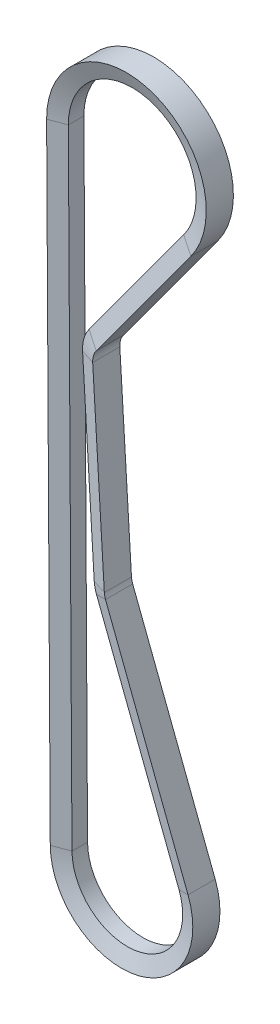
from build123d import *


with BuildPart() as part:
    # Sweep1: sweep along a path in Sketch2
    with BuildLine(Plane.XY) as sweep1_path:
        Line((24.305304687, 203.443011904), (-8.902554145, 158.126250847))
        ThreePointArc((-8.902554145, 158.126250847), (-9.872370593, 156.165208625), (-10.1190974, 153.991420129))
        Line((-10.1190974, 153.991420129), (-6.034091354, 86.114231578))
        ThreePointArc((-6.034091354, 86.114231578), (-5.901062985, 85.148765527), (-5.621860178, 84.215027323))
        Line((-5.621860178, 84.215027323), (23.331891345, 8.979022567))
        ThreePointArc((23.331891345, 8.979022567), (4.637808449, -24.566048376), (-24.999576916, -0.145444194))
        Line((-24.999576916, -0.145444194), (-26.27936682, 219.830377518))
        ThreePointArc((-26.27936682, 219.830377518), (10.349488254, 246.630367241), (24.305304687, 203.443011904))
    # Sketch3 → Sweep1 (sweep)
    with BuildSketch(Plane(origin=(23.331891345, 8.979022567, 0), x_dir=(0, 0, -1), z_dir=(0.35916090269146084, -0.9332756538010918, 0))):
        Polygon((-4.7625, 0), (4.7625, 0), (2.728634331, -5.588), (-2.728634331, -5.588), align=None)
    sweep(path=sweep1_path.line)


solid = part.part
